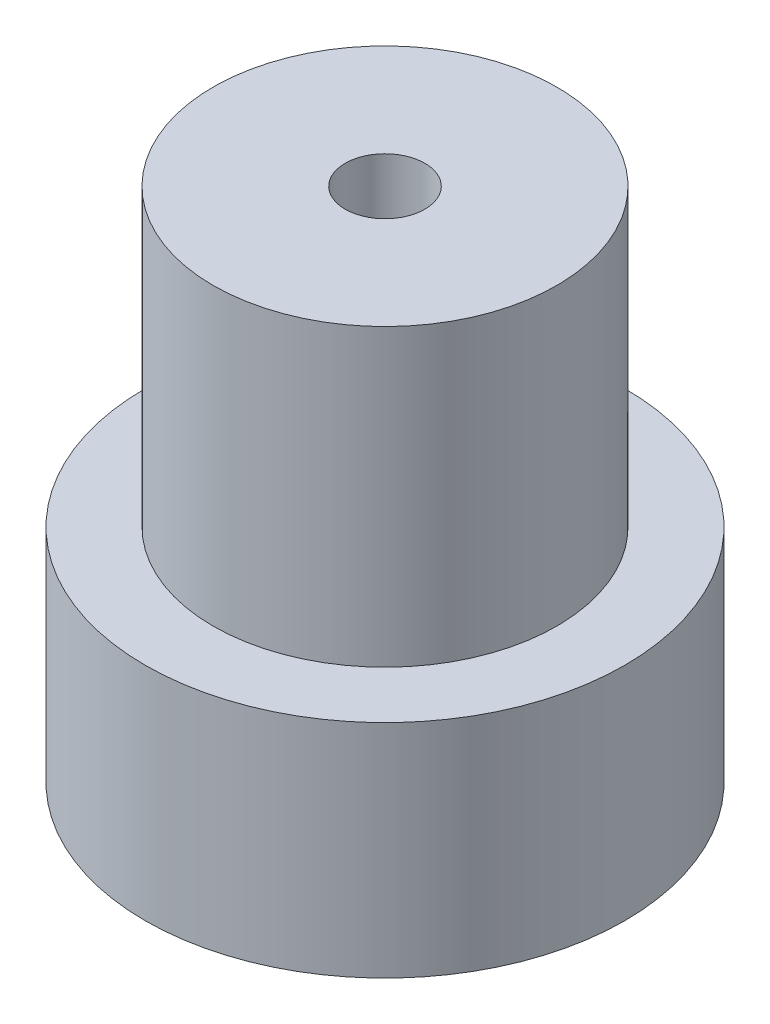
from build123d import *

# Parameters (mm, degrees)
SKETCH1_R           = 16.25
BOSS_EXTRUDE1_DEPTH = 15
SKETCH2_R           = 11.65
BOSS_EXTRUDE2_DEPTH = 20
SKETCH4_R           = 2.7
CUT_EXTRUDE1_DEPTH  = 30


with BuildPart() as part:
    # Sketch1 → Boss-Extrude1 (new body)
    with BuildSketch(Plane(origin=(0, 0, 0), x_dir=(1, 0, 0), z_dir=(0, 1, 0))):
        Circle(SKETCH1_R)
    extrude(amount=BOSS_EXTRUDE1_DEPTH)

    # Sketch2 → Boss-Extrude2 (add)
    with BuildSketch(Plane(origin=(0, 15, 0), x_dir=(1, 0, 0), z_dir=(0, 1, 0))):
        Circle(SKETCH2_R)
    extrude(amount=BOSS_EXTRUDE2_DEPTH)

    # Sketch4 → Cut-Extrude1 (cut)
    with BuildSketch(Plane(origin=(0, 35, 0), x_dir=(1, 0, 0), z_dir=(0, 1, 0))):
        Circle(SKETCH4_R)
    extrude(amount=-CUT_EXTRUDE1_DEPTH, mode=Mode.SUBTRACT)


solid = part.part
